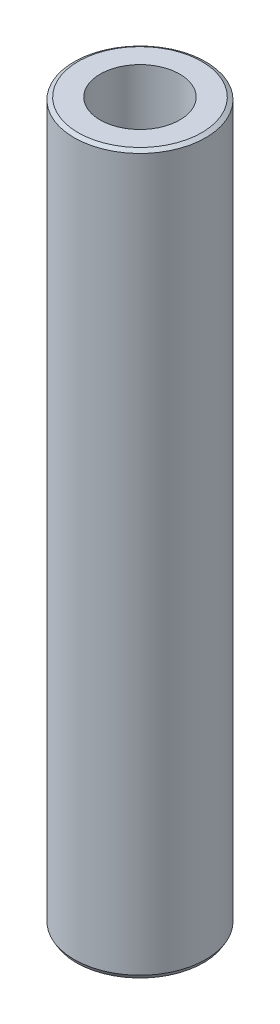
from build123d import *
from OCP.BRepFilletAPI import BRepFilletAPI_MakeChamfer

# Parameters (mm, degrees)
SKETCH1_R           = 55
BOSS_EXTRUDE1_DEPTH = 600
SKETCH2_R           = 33.249363977
CUT_EXTRUDE1_DEPTH  = 606.020660804
CHAMFER1_SIZE       = 1.952145855
CHAMFER1_SIZE2      = 3.381215805


with BuildPart() as part:
    # Sketch1 → Boss-Extrude1 (new body)
    with BuildSketch(Plane(origin=(0, 0, 0), x_dir=(1, 0, 0), z_dir=(0, 1, 0))):
        Circle(SKETCH1_R)
    extrude(amount=BOSS_EXTRUDE1_DEPTH)

    # Sketch2 → Cut-Extrude1 (cut, through all)
    with BuildSketch(Plane(origin=(0, 0, 0), x_dir=(1, 0, 0), z_dir=(0, 1, 0))):
        Circle(SKETCH2_R)
    extrude(amount=CUT_EXTRUDE1_DEPTH, mode=Mode.SUBTRACT)

    # Chamfer1: one chamfer whose edges measure the first distance from different faces: ONE call of the kernel's chamfer builder (chamfer() names one face for all edges)
    chamfer1_edges_1 = [part.edges().sort_by_distance(p)[0] for p in [
        (-55, 600, 0),
    ]]
    chamfer1_side_1 = [part.faces().sort_by_distance(p)[0] for p in [
        (-55, 300, 0),
    ]]
    chamfer1_edges_2 = [part.edges().sort_by_distance(p)[0] for p in [
        (-55, 0, 0),
    ]]
    chamfer1_side_2 = [part.faces().sort_by_distance(p)[0] for p in [
        (-53.444365081, 0, 0),
    ]]
    chamfer1 = BRepFilletAPI_MakeChamfer(part.part.solid().wrapped)
    for e in chamfer1_edges_1:
        chamfer1.Add(CHAMFER1_SIZE, CHAMFER1_SIZE2, e.wrapped, chamfer1_side_1[0].wrapped)  # the first distance lies on this face
    for e in chamfer1_edges_2:
        chamfer1.Add(CHAMFER1_SIZE, CHAMFER1_SIZE2, e.wrapped, chamfer1_side_2[0].wrapped)  # the first distance lies on this face
    add(Compound.cast(chamfer1.Shape()), mode=Mode.REPLACE)


solid = part.part
